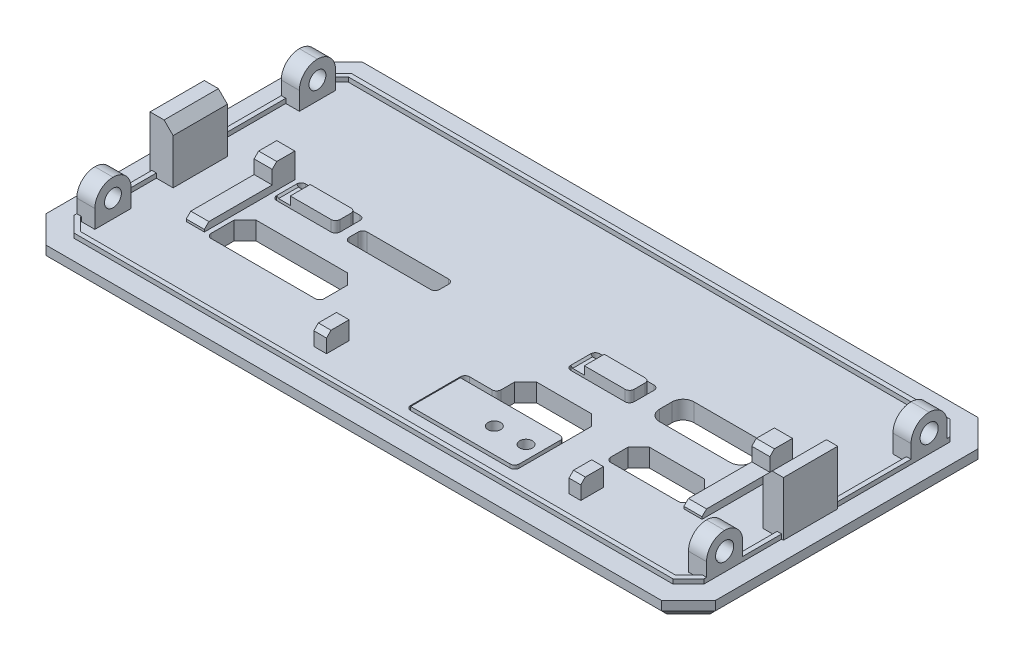
from build123d import *

# Parameters (mm, degrees)
EXTRUDE_1_DEPTH               = 2
CHAMFER_1_SIZE                = 1
CUT_EXTRUDE_1_REACH           = 52.306
SKETCH_3_W                    = 12.5
SKETCH_3_H                    = 4.25
SKETCH_3_W_2                  = 8.5
SKETCH_3_H_2                  = 3.6
SKETCH_3_W_3                  = 10.2
SKETCH_3_H_3                  = 3.8
SKETCH_3_W_4                  = 7
SKETCH_3_H_4                  = 3.2
SKETCH_3_W_5                  = 10
SKETCH_3_H_5                  = 2
FILLET_1_R                    = 1.2
FILLET_2_R                    = 0.5
CHAMFER_2_SIZE                = 1.2
SKETCH_4_W                    = 3.5
SKETCH_4_H                    = 2.2
EXTRUDE_2_DEPTH               = 1
SKETCH_4_W_2                  = 6.5
SKETCH_4_H_2                  = 5.5
EXTRUDE_2_2_DEPTH             = 1
SKETCH_4_W_3                  = 4.5
EXTRUDE_2_3_DEPTH             = 1
SKETCH_5_W                    = 6.5
SKETCH_5_H                    = 2.2
EXTRUDE_3_DEPTH               = 0.8
SKETCH_16_W                   = 5
SKETCH_16_H                   = 2.2
EXTRUDE_10_DEPTH              = 0.9
SKETCH_6_W                    = 11.5
SKETCH_6_H                    = 5.5
EXTRUDE_4_DEPTH               = 0.9
FILLET_5_R                    = 1
FILLET_3_R                    = 0.5
CHAMFER_3_SIZE                = 0.2
SKETCH_7_W                    = 1.4
SKETCH_7_H                    = 2.5
SKETCH_7_W_2                  = 1.3
EXTRUDE_5_DEPTH               = 2
SKETCH_11_W                   = 2
SKETCH_11_H                   = 10
EXTRUDE_7_DEPTH               = 0.75
SKETCH_12_W                   = 2
SKETCH_12_H                   = 2.5
EXTRUDE_8_DEPTH               = 2
CHAMFER_4_SIZE                = 0.5
SKETCH_8_W                    = 2
SKETCH_8_H                    = 4
EXTRUDE_6_DEPTH               = 4
FILLET_4_R                    = 2
SKETCH_9_R                    = 1
CUT_EXTRUDE_2_DEPTH           = 2
CUT_EXTRUDE_2_DRAFT           = -2
CUT_EXTRUDE_2_PROFILE_2_DEPTH = 2
CUT_EXTRUDE_2_PROFILE_2_DRAFT = -2
SKETCH_10_R                   = 1
CUT_EXTRUDE_3_DEPTH           = 2
CUT_EXTRUDE_3_DRAFT           = -2
CUT_EXTRUDE_3_PROFILE_2_DEPTH = 2
CUT_EXTRUDE_3_PROFILE_2_DRAFT = -2
SKETCH_13_W                   = 2.25
SKETCH_13_H                   = 6
SKETCH_13_W_2                 = 2.55
EXTRUDE_9_DEPTH               = 6
CHAMFER_5_SIZE                = 1
CUT_EXTRUDE_4_REACH           = 52.898
SKETCH_14_R                   = 0.7
EXTRUDE_11_DEPTH              = 0.5


# Some blends are built 0.0001 mm under size
with BuildPart() as part:
    # 草图2 → 凸台-拉伸1 (new body)
    with BuildSketch(Plane(origin=(0, 0, 0), x_dir=(1, 0, 0), z_dir=(0, 1, 0))):
        Polygon((-36.762377201, 30.76395027), (-33.762377201, 33.76395027), (34.237622799, 33.76395027), (37.237622799, 30.76395027), (37.237622799, 1.76395027), (34.237622799, -1.23604973), (-33.762377201, -1.23604973), (-36.762377201, 1.76395027), align=None)
    extrude(amount=EXTRUDE_1_DEPTH)

    # 倒角1
    chamfer_1_edges = [part.edges().sort_by_distance(p)[0] for p in [
        (-35.262377201, 0, -0.26395027),
        (-36.762377201, 0, -16.26395027),
        (-35.262377201, 0, -32.26395027),
        (0.237622799, 0, -33.76395027),
        (35.737622799, 0, -32.26395027),
        (37.237622799, 0, -16.26395027),
        (35.737622799, 0, -0.26395027),
        (0.237622799, 0, 1.23604973),
    ]]
    chamfer(chamfer_1_edges, length=CHAMFER_1_SIZE)

    # 草图3 → 切除-拉伸1 (cut, up to next)
    with BuildSketch(Plane.XZ, mode=Mode.PRIVATE) as cut_extrude_1_sk1:
        with Locations((-19.512377201, -10.63895027)):
            Rectangle(SKETCH_3_W, SKETCH_3_H)
    cut_extrude_1_tool1 = extrude(cut_extrude_1_sk1.sketch, amount=-CUT_EXTRUDE_1_REACH, mode=Mode.PRIVATE) & part.part
    # 草图3 → 切除-拉伸1 (cut, up to next)
    with BuildSketch(Plane.XZ, mode=Mode.PRIVATE) as cut_extrude_1_sk2:
        Polygon((1.737622799, -3.06395027), (13.737622799, -3.06395027), (13.737622799, -12.76395027), (5.237622799, -12.76395027), (5.237622799, -9.56395027), (1.737622799, -9.56395027), align=None)
    cut_extrude_1_tool2 = extrude(cut_extrude_1_sk2.sketch, amount=-CUT_EXTRUDE_1_REACH, mode=Mode.PRIVATE) & part.part
    # 草图3 → 切除-拉伸1 (cut, up to next)
    with BuildSketch(Plane.XZ, mode=Mode.PRIVATE) as cut_extrude_1_sk3:
        with Locations((21.987622799, -10.96395027)):
            Rectangle(SKETCH_3_W_2, SKETCH_3_H_2)
    cut_extrude_1_tool3 = extrude(cut_extrude_1_sk3.sketch, amount=-CUT_EXTRUDE_1_REACH, mode=Mode.PRIVATE) & part.part
    # 草图3 → 切除-拉伸1 (cut, up to next)
    with BuildSketch(Plane.XZ, mode=Mode.PRIVATE) as cut_extrude_1_sk4:
        with Locations((20.937622799, -17.66395027)):
            Rectangle(SKETCH_3_W_3, SKETCH_3_H_3)
    cut_extrude_1_tool4 = extrude(cut_extrude_1_sk4.sketch, amount=-CUT_EXTRUDE_1_REACH, mode=Mode.PRIVATE) & part.part
    # 草图3 → 切除-拉伸1 (cut, up to next)
    with BuildSketch(Plane.XZ, mode=Mode.PRIVATE) as cut_extrude_1_sk5:
        with Locations((10.237622799, -17.36395027)):
            Rectangle(SKETCH_3_W_4, SKETCH_3_H_4)
    cut_extrude_1_tool5 = extrude(cut_extrude_1_sk5.sketch, amount=-CUT_EXTRUDE_1_REACH, mode=Mode.PRIVATE) & part.part
    # 草图3 → 切除-拉伸1 (cut, up to next)
    with BuildSketch(Plane.XZ, mode=Mode.PRIVATE) as cut_extrude_1_sk6:
        with Locations((-22.262377201, -17.36395027)):
            Rectangle(SKETCH_3_W_4, SKETCH_3_H_4)
    cut_extrude_1_tool6 = extrude(cut_extrude_1_sk6.sketch, amount=-CUT_EXTRUDE_1_REACH, mode=Mode.PRIVATE) & part.part
    # 草图3 → 切除-拉伸1 (cut, up to next)
    with BuildSketch(Plane.XZ, mode=Mode.PRIVATE) as cut_extrude_1_sk7:
        with Locations((-12.762377201, -16.76395027)):
            Rectangle(SKETCH_3_W_5, SKETCH_3_H_5)
    cut_extrude_1_tool7 = extrude(cut_extrude_1_sk7.sketch, amount=-CUT_EXTRUDE_1_REACH, mode=Mode.PRIVATE) & part.part
    add(cut_extrude_1_tool1.solids().sort_by_distance((-19.512377, 0, -10.63895))[0], mode=Mode.SUBTRACT)
    add(cut_extrude_1_tool2.solids().sort_by_distance((8.190094, 0, -7.567943))[0], mode=Mode.SUBTRACT)
    add(cut_extrude_1_tool3.solids().sort_by_distance((21.987623, 0, -10.96395))[0], mode=Mode.SUBTRACT)
    add(cut_extrude_1_tool4.solids().sort_by_distance((20.937623, 0, -17.66395))[0], mode=Mode.SUBTRACT)
    add(cut_extrude_1_tool5.solids().sort_by_distance((10.237623, 0, -17.36395))[0], mode=Mode.SUBTRACT)
    add(cut_extrude_1_tool6.solids().sort_by_distance((-22.262377, 0, -17.36395))[0], mode=Mode.SUBTRACT)
    add(cut_extrude_1_tool7.solids().sort_by_distance((-12.762377, 0, -16.76395))[0], mode=Mode.SUBTRACT)

    # 圆角1
    fillet_1_edges = [part.edges().sort_by_distance(p)[0] for p in [
        (15.837622799, 1, -19.56395027),
        (15.837622799, 1, -15.76395027),
        (26.037622799, 1, -15.76395027),
        (26.037622799, 1, -19.56395027),
    ]]
    fillet(fillet_1_edges, radius=FILLET_1_R)

    # 圆角2
    fillet_2_edges = [part.edges().sort_by_distance(p)[0] for p in [
        (6.737622799, 1, -18.96395027),
        (6.737622799, 1, -15.76395027),
        (13.737622799, 1, -15.76395027),
        (13.737622799, 1, -18.96395027),
        (17.737622799, 1, -9.16395027),
        (26.237622799, 1, -9.16395027),
        (1.737622799, 1, -9.56395027),
        (1.737622799, 1, -3.06395027),
        (13.737622799, 1, -3.06395027),
        (5.237622799, 1, -9.56395027),
        (-25.762377201, 1, -8.51395027),
        (-13.262377201, 1, -8.51395027),
        (-17.762377201, 1, -17.76395027),
        (-17.762377201, 1, -15.76395027),
        (-7.762377201, 1, -15.76395027),
        (-7.762377201, 1, -17.76395027),
        (-25.762377201, 1, -18.96395027),
        (-25.762377201, 1, -15.76395027),
        (-18.762377201, 1, -15.76395027),
        (-18.762377201, 1, -18.96395027),
    ]]
    fillet(fillet_2_edges, radius=FILLET_2_R)

    # 倒角2
    chamfer_2_edges = [part.edges().sort_by_distance(p)[0] for p in [
        (17.737622799, 1, -12.76395027),
        (26.237622799, 1, -12.76395027),
        (13.737622799, 1, -12.76395027),
        (5.237622799, 1, -12.76395027),
        (-25.762377201, 1, -12.76395027),
        (-13.262377201, 1, -12.76395027),
    ]]
    chamfer(chamfer_2_edges, length=CHAMFER_2_SIZE)



with BuildPart() as body_2:
    # 草图4 → 凸台-拉伸2 (new body)
    with BuildSketch(Plane.XZ):
        with Locations((-21.012377201, -17.36395027)):
            Rectangle(SKETCH_4_W, SKETCH_4_H)
    extrude(amount=-EXTRUDE_2_DEPTH)


with BuildPart() as body_3:
    # 草图4 → Extrude 2 2 (new body)
    with BuildSketch(Plane.XZ):
        with Locations((9.987622799, -6.31395027)):
            Rectangle(SKETCH_4_W_2, SKETCH_4_H_2)
    extrude(amount=-EXTRUDE_2_2_DEPTH)


with BuildPart() as body_4:
    # 草图4 → Extrude 2 3 (new body)
    with BuildSketch(Plane.XZ):
        with Locations((10.987622799, -17.36395027)):
            Rectangle(SKETCH_4_W_3, SKETCH_4_H)
    extrude(amount=-EXTRUDE_2_3_DEPTH)


with BuildPart() as part_1:
    add(part.part)

    add(body_2.part)  # 凸台-拉伸3 merges body 2

    add(body_4.part)  # 凸台-拉伸3 merges body 4
    # 草图5 → 凸台-拉伸3 (add)
    with BuildSketch(Plane(origin=(0, 1, 0), x_dir=(1, 0, 0), z_dir=(0, 1, 0))):
        with Locations((-22.512377201, 17.36395027)):
            Rectangle(SKETCH_5_W, SKETCH_5_H)
        with Locations((9.987622799, 17.36395027)):
            Rectangle(SKETCH_5_W, SKETCH_5_H)
    extrude(amount=EXTRUDE_3_DEPTH)

    # 草图16 → 凸台-拉伸10 (add)
    with BuildSketch(Plane(origin=(0, 1.8, 0), x_dir=(1, 0, 0), z_dir=(0, 1, 0))):
        with Locations((10.737622799, 17.36395027)):
            Rectangle(SKETCH_16_W, SKETCH_16_H)
        with Locations((-21.762377201, 17.36395027)):
            Rectangle(SKETCH_16_W, SKETCH_16_H)
    extrude(amount=EXTRUDE_10_DEPTH)


    add(body_3.part)  # 凸台-拉伸4 merges body 3
    # 草图6 → 凸台-拉伸4 (add)
    with BuildSketch(Plane(origin=(0, 1, 0), x_dir=(1, 0, 0), z_dir=(0, 1, 0))):
        with Locations((7.487622799, 6.31395027)):
            Rectangle(SKETCH_6_W, SKETCH_6_H)
    extrude(amount=EXTRUDE_4_DEPTH)

    # 圆角5
    fillet_5_edges = [part_1.edges().sort_by_distance(p)[0] for p in [
        (1.737622799, 1, -6.31395027),
        (6.737622799, 1, -17.36395027),
        (-25.762377201, 1, -17.36395027),
    ]]
    fillet(fillet_5_edges, radius=FILLET_5_R - 0.0001)  # a hair under: the kernel refuses the full size

    # 圆角3
    fillet_3_edges = [part_1.edges().sort_by_distance(p)[0] for p in [
        (-19.262377201, 1.35, -16.26395027),
        (-19.262377201, 1.35, -18.46395027),
        (-22.762377201, 0.5, -16.26395027),
        (-22.762377201, 0.5, -18.46395027),
        (13.237622799, 1.35, -16.26395027),
        (13.237622799, 1.35, -18.46395027),
        (8.737622799, 0.5, -16.26395027),
        (8.737622799, 0.5, -18.46395027),
        (6.737622799, 0.5, -9.06395027),
        (13.237622799, 0.95, -9.06395027),
        (13.237622799, 0.95, -3.56395027),
        (6.737622799, 0.5, -3.56395027),
    ]]
    fillet(fillet_3_edges, radius=FILLET_3_R)

    # 倒角3
    # the kernel refuses this chamfer: 0.2 mm, written as the material it adds along each edge
    with BuildSketch(Plane(origin=(-25.762377201, 1.8, -16.26395027), x_dir=(0.9996219169112968, -0.02749587661058658, 0), z_dir=(0, 0, -1))) as chamfer_3_piece_1_section:
        Polygon((CHAMFER_3_SIZE * 0.999621916911, -CHAMFER_3_SIZE * 0.0274958766106), (-CHAMFER_3_SIZE * 0.0274958766106, -CHAMFER_3_SIZE * 0.999621916911), (0, 0), align=None)
    chamfer_3_piece_1 = extrude(amount=2.2, mode=Mode.PRIVATE)
    chamfer_3_piece_1 = split(chamfer_3_piece_1, bisect_by=Plane(origin=(-25.696296371, 2, -17.36395027), z_dir=(0, -1, 0)), keep=Keep.TOP, mode=Mode.PRIVATE)
    add(chamfer_3_piece_1)
    with BuildSketch(Plane(origin=(6.737622799, 1.8, -16.26395027), x_dir=(0.9996219169112968, -0.027495876610586226, 0), z_dir=(0, 0, -1))) as chamfer_3_piece_2_section:
        Polygon((CHAMFER_3_SIZE * 0.999621916911, -CHAMFER_3_SIZE * 0.0274958766106), (-CHAMFER_3_SIZE * 0.0274958766106, -CHAMFER_3_SIZE * 0.999621916911), (0, 0), align=None)
    chamfer_3_piece_2 = extrude(amount=2.2, mode=Mode.PRIVATE)
    chamfer_3_piece_2 = split(chamfer_3_piece_2, bisect_by=Plane(origin=(6.803703629, 2, -17.36395027), z_dir=(0, -1, 0)), keep=Keep.TOP, mode=Mode.PRIVATE)
    add(chamfer_3_piece_2)

    # 草图7 → 凸台-拉伸5 (add)
    with BuildSketch(Plane(origin=(0, 2, 0), x_dir=(1, 0, 0), z_dir=(0, 1, 0))):
        with Locations((-8.562377201, 5.11395027)):
            Rectangle(SKETCH_7_W, SKETCH_7_H)
        with Locations((19.587622799, 5.11395027)):
            Rectangle(SKETCH_7_W_2, SKETCH_7_H)
    extrude(amount=EXTRUDE_5_DEPTH)

    # 草图11 → 凸台-拉伸7 (add)
    with BuildSketch(Plane(origin=(0, 2, 0), x_dir=(1, 0, 0), z_dir=(0, 1, 0))):
        with Locations((27.737622799, 13.76395027)):
            Rectangle(SKETCH_11_W, SKETCH_11_H)
        with Locations((-27.262377201, 13.76395027)):
            Rectangle(SKETCH_11_W, SKETCH_11_H)
    extrude(amount=EXTRUDE_7_DEPTH)

    # 草图12 → 凸台-拉伸8 (add)
    with BuildSketch(Plane(origin=(0, 2.75, 0), x_dir=(1, 0, 0), z_dir=(0, 1, 0))):
        with Locations((27.737622799, 17.51395027)):
            Rectangle(SKETCH_12_W, SKETCH_12_H)
        with Locations((-27.262377201, 17.51395027)):
            Rectangle(SKETCH_12_W, SKETCH_12_H)
    extrude(amount=EXTRUDE_8_DEPTH)

    # 倒角4
    chamfer_4_edges = [part_1.edges().sort_by_distance(p)[0] for p in [
        (-8.562377201, 4, -3.86395027),
        (19.587622799, 4, -3.86395027),
        (27.737622799, 2.75, -8.76395027),
        (-27.262377201, 2.75, -8.76395027),
        (27.737622799, 4.75, -16.26395027),
        (-27.262377201, 4.75, -16.26395027),
    ]]
    chamfer(chamfer_4_edges, length=CHAMFER_4_SIZE)

    # 草图8 → 凸台-拉伸6 (add)
    with BuildSketch(Plane(origin=(0, 2, 0), x_dir=(1, 0, 0), z_dir=(0, 1, 0))):
        with Locations((34.037622799, 4.96395027)):
            Rectangle(SKETCH_8_W, SKETCH_8_H)
        with Locations((34.037622799, 27.56395027)):
            Rectangle(SKETCH_8_W, SKETCH_8_H)
        with Locations((-33.562377201, 4.96395027)):
            Rectangle(SKETCH_8_W, SKETCH_8_H)
        with Locations((-33.562377201, 27.56395027)):
            Rectangle(SKETCH_8_W, SKETCH_8_H)
    extrude(amount=EXTRUDE_6_DEPTH)

    # 圆角4
    fillet_4_edges = [part_1.edges().sort_by_distance(p)[0] for p in [
        (34.037622799, 6, -6.96395027),
        (34.037622799, 6, -2.96395027),
        (34.037622799, 6, -29.56395027),
        (34.037622799, 6, -25.56395027),
        (-33.562377201, 6, -25.56395027),
        (-33.562377201, 6, -29.56395027),
        (-33.562377201, 6, -2.96395027),
        (-33.562377201, 6, -6.96395027),
    ]]
    fillet(fillet_4_edges, radius=FILLET_4_R - 0.0001)  # a hair under: the kernel refuses the full size


with BuildPart() as cut_extrude_2_tool:
    # 草图9 → 切除-拉伸2 (with draft: the straight prism first)
    with BuildSketch(Plane.ZY.offset(34.562377201)):
        with Locations((-4.96395027, 4)):
            Circle(SKETCH_9_R)
    extrude(amount=-CUT_EXTRUDE_2_DEPTH)
    # 切除-拉伸2: the draft: its side faces are tilted about the plane it starts from
    cut_extrude_2_sides = [cut_extrude_2_tool.faces().sort_by_distance(p)[0] for p in [
        (-33.562377201, 4, -5.96395027),
    ]]
    draft(cut_extrude_2_sides, Plane.ZY.offset(34.562377201), CUT_EXTRUDE_2_DRAFT)


with BuildPart() as part_2:
    add(part_1.part)

    # 切除-拉伸2: cut by cut_extrude_2_tool
    add(cut_extrude_2_tool.part, mode=Mode.SUBTRACT)


with BuildPart() as cut_extrude_2_profile_2_tool:
    # 草图9 → 切除-拉伸2 profile 2 (with draft: the straight prism first)
    with BuildSketch(Plane.ZY.offset(34.562377201)):
        with Locations((-27.56395027, 4)):
            Circle(SKETCH_9_R)
    extrude(amount=-CUT_EXTRUDE_2_PROFILE_2_DEPTH)
    # 切除-拉伸2 profile 2: the draft: its side faces are tilted about the plane it starts from
    cut_extrude_2_profile_2_sides = [cut_extrude_2_profile_2_tool.faces().sort_by_distance(p)[0] for p in [
        (-33.562377201, 4, -28.56395027),
    ]]
    draft(cut_extrude_2_profile_2_sides, Plane.ZY.offset(34.562377201), CUT_EXTRUDE_2_PROFILE_2_DRAFT)


with BuildPart() as part_3:
    add(part_2.part)

    # 切除-拉伸2 profile 2: cut by cut_extrude_2_profile_2_tool
    add(cut_extrude_2_profile_2_tool.part, mode=Mode.SUBTRACT)


with BuildPart() as cut_extrude_3_tool:
    # 草图10 → 切除-拉伸3 (with draft: the straight prism first)
    with BuildSketch(Plane(origin=(35.037622799, 0, 0), x_dir=(0, 0, -1), z_dir=(1, 0, 0))):
        with Locations((4.96395027, 4)):
            Circle(SKETCH_10_R)
    extrude(amount=-CUT_EXTRUDE_3_DEPTH)
    # 切除-拉伸3: the draft: its side faces are tilted about the plane it starts from
    cut_extrude_3_sides = [cut_extrude_3_tool.faces().sort_by_distance(p)[0] for p in [
        (34.037622799, 4, -3.96395027),
    ]]
    draft(cut_extrude_3_sides, Plane(origin=(35.037622799, 0, 0), x_dir=(0, 0, -1), z_dir=(1, 0, 0)), CUT_EXTRUDE_3_DRAFT)


with BuildPart() as part_4:
    add(part_3.part)

    # 切除-拉伸3: cut by cut_extrude_3_tool
    add(cut_extrude_3_tool.part, mode=Mode.SUBTRACT)


with BuildPart() as cut_extrude_3_profile_2_tool:
    # 草图10 → 切除-拉伸3 profile 2 (with draft: the straight prism first)
    with BuildSketch(Plane(origin=(35.037622799, 0, 0), x_dir=(0, 0, -1), z_dir=(1, 0, 0))):
        with Locations((27.56395027, 4)):
            Circle(SKETCH_10_R)
    extrude(amount=-CUT_EXTRUDE_3_PROFILE_2_DEPTH)
    # 切除-拉伸3 profile 2: the draft: its side faces are tilted about the plane it starts from
    cut_extrude_3_profile_2_sides = [cut_extrude_3_profile_2_tool.faces().sort_by_distance(p)[0] for p in [
        (34.037622799, 4, -26.56395027),
    ]]
    draft(cut_extrude_3_profile_2_sides, Plane(origin=(35.037622799, 0, 0), x_dir=(0, 0, -1), z_dir=(1, 0, 0)), CUT_EXTRUDE_3_PROFILE_2_DRAFT)


with BuildPart() as part_5:
    add(part_4.part)

    # 切除-拉伸3 profile 2: cut by cut_extrude_3_profile_2_tool
    add(cut_extrude_3_profile_2_tool.part, mode=Mode.SUBTRACT)

    # 草图13 → 凸台-拉伸9 (add)
    with BuildSketch(Plane(origin=(0, 2, 0), x_dir=(1, 0, 0), z_dir=(0, 1, 0))):
        with Locations((34.112622799, 14.26395027)):
            Rectangle(SKETCH_13_W, SKETCH_13_H)
        with Locations((-33.487377201, 14.26395027)):
            Rectangle(SKETCH_13_W_2, SKETCH_13_H)
    extrude(amount=EXTRUDE_9_DEPTH)

    # 倒角5
    chamfer_5_edges = [part_5.edges().sort_by_distance(p)[0] for p in [
        (32.987622799, 8, -14.26395027),
        (-32.212377201, 8, -14.26395027),
    ]]
    chamfer(chamfer_5_edges, length=CHAMFER_5_SIZE)

    # 草图14 → 切除-拉伸4 (cut, up to next)
    with BuildSketch(Plane.XZ, mode=Mode.PRIVATE) as cut_extrude_4_sk1:
        with Locations(Location((11.737622799, -6.31395027, 0), (0, 0, 270))):
            Circle(SKETCH_14_R)
    cut_extrude_4_tool1 = extrude(cut_extrude_4_sk1.sketch, amount=-CUT_EXTRUDE_4_REACH, mode=Mode.PRIVATE) & part_5.part
    # 草图14 → 切除-拉伸4 (cut, up to next)
    with BuildSketch(Plane.XZ, mode=Mode.PRIVATE) as cut_extrude_4_sk2:
        with Locations(Location((8.237622799, -6.31395027, 0), (0, 0, 270))):
            Circle(SKETCH_14_R)
    cut_extrude_4_tool2 = extrude(cut_extrude_4_sk2.sketch, amount=-CUT_EXTRUDE_4_REACH, mode=Mode.PRIVATE) & part_5.part
    add(cut_extrude_4_tool1.solids().sort_by_distance((11.737623, 0, -6.31395))[0], mode=Mode.SUBTRACT)
    add(cut_extrude_4_tool2.solids().sort_by_distance((8.237623, 0, -6.31395))[0], mode=Mode.SUBTRACT)

    # 草图17 → 凸台-拉伸11 (add)
    with BuildSketch(Plane(origin=(0, 2, 0), x_dir=(1, 0, 0), z_dir=(0, 1, 0))):
        Polygon((33.326352961, 31.56395027), (-32.851107364, 31.56395027), (-34.562377201, 29.852680433), (-34.562377201, 2.675220108), (-32.851107364, 0.96395027), (33.326352961, 0.96395027), (35.037622799, 2.675220108), (35.037622799, 29.852680433), align=None)
        Polygon((33.11924618, 31.06395027), (-32.644000583, 31.06395027), (-34.062377201, 29.645573652), (-34.062377201, 2.882326889), (-32.644000583, 1.46395027), (33.11924618, 1.46395027), (34.537622799, 2.882326889), (34.537622799, 29.645573652), align=None, mode=Mode.SUBTRACT)
    extrude(amount=EXTRUDE_11_DEPTH)


solid = part_5.part
